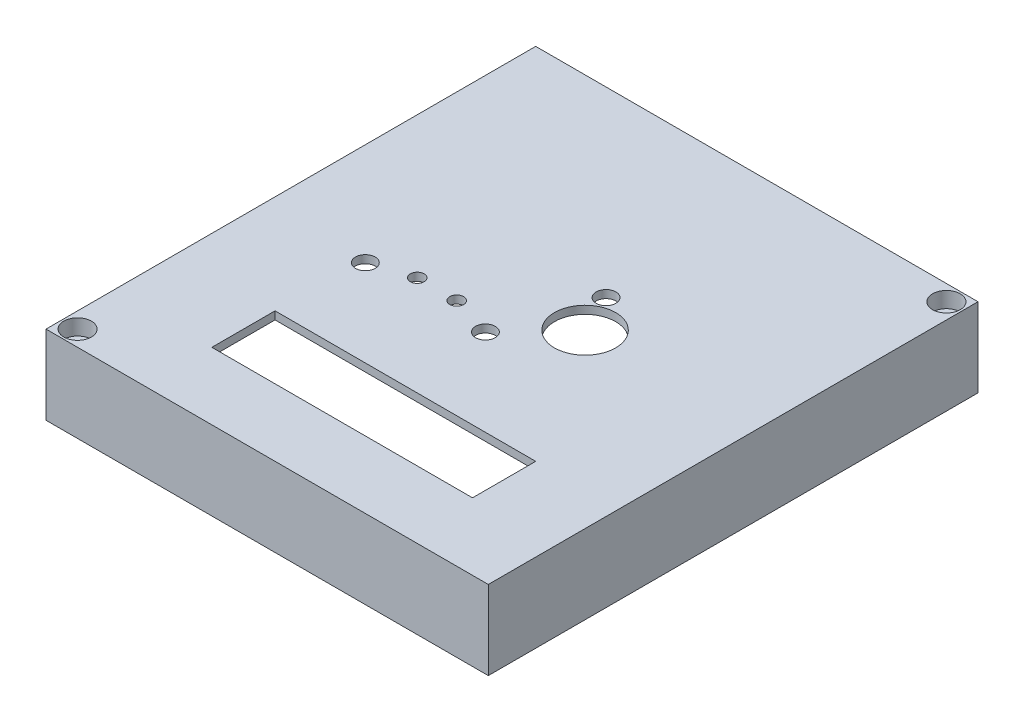
from build123d import *

# Parameters (mm, degrees)
SKETCH1_W           = 112
SKETCH1_H           = 124
BOSS_EXTRUDE1_DEPTH = 2
SKETCH4_W           = 112
SKETCH4_H           = 124
BOSS_EXTRUDE2_DEPTH = 18
CUT_EXTRUDE1_REACH  = 87.907
SKETCH5_W           = 66
SKETCH5_H           = 16
SKETCH5_R           = 7.75
SKETCH5_R_2         = 2.5
SKETCH5_R_3         = 1.75
SKETCH6_R           = 2
CUT_EXTRUDE2_DEPTH  = 86.90692638
SKETCH7_R           = 3.5
CUT_EXTRUDE3_DEPTH  = 4
CUT_EXTRUDE4_DEPTH  = 20
CUT_EXTRUDE5_REACH  = 139.244


with BuildPart() as part:
    # Sketch1 → Boss-Extrude1 (new body)
    with BuildSketch(Plane(origin=(0, 0, 0), x_dir=(1, 0, 0), z_dir=(0, 1, 0))):
        Rectangle(SKETCH1_W, SKETCH1_H)
    extrude(amount=BOSS_EXTRUDE1_DEPTH)

    # Sketch4 → Boss-Extrude2 (add)
    with BuildSketch(Plane.XZ):
        Rectangle(SKETCH4_W, SKETCH4_H)
        Polygon((-48, 58), (-48, 54), (-52, 54), (-52, -58), (48, -58), (48, -54), (52, -54), (52, 58), align=None, mode=Mode.SUBTRACT)
    extrude(amount=BOSS_EXTRUDE2_DEPTH)

    # Sketch5 → Cut-Extrude1 (cut, up to next)
    with BuildSketch(Plane(origin=(0, 2, 0), x_dir=(1, 0, 0), z_dir=(0, 1, 0)), mode=Mode.PRIVATE) as cut_extrude1_sk1:
        with Locations((2, -37)):
            Rectangle(SKETCH5_W, SKETCH5_H)
    cut_extrude1_tool1 = extrude(cut_extrude1_sk1.sketch, amount=-CUT_EXTRUDE1_REACH, mode=Mode.PRIVATE) & part.part
    # Sketch5 → Cut-Extrude1 (cut, up to next)
    with BuildSketch(Plane(origin=(0, 2, 0), x_dir=(1, 0, 0), z_dir=(0, 1, 0)), mode=Mode.PRIVATE) as cut_extrude1_sk2:
        with Locations((12.5, 6)):
            Circle(SKETCH5_R)
    cut_extrude1_tool2 = extrude(cut_extrude1_sk2.sketch, amount=-CUT_EXTRUDE1_REACH, mode=Mode.PRIVATE) & part.part
    # Sketch5 → Cut-Extrude1 (cut, up to next)
    with BuildSketch(Plane(origin=(0, 2, 0), x_dir=(1, 0, 0), z_dir=(0, 1, 0)), mode=Mode.PRIVATE) as cut_extrude1_sk3:
        with Locations((-30.13, -7.01)):
            Circle(SKETCH5_R_2)
    cut_extrude1_tool3 = extrude(cut_extrude1_sk3.sketch, amount=-CUT_EXTRUDE1_REACH, mode=Mode.PRIVATE) & part.part
    # Sketch5 → Cut-Extrude1 (cut, up to next)
    with BuildSketch(Plane(origin=(0, 2, 0), x_dir=(1, 0, 0), z_dir=(0, 1, 0)), mode=Mode.PRIVATE) as cut_extrude1_sk4:
        with Locations((-20.25, -3.7495)):
            Circle(SKETCH5_R_3)
    cut_extrude1_tool4 = extrude(cut_extrude1_sk4.sketch, amount=-CUT_EXTRUDE1_REACH, mode=Mode.PRIVATE) & part.part
    # Sketch5 → Cut-Extrude1 (cut, up to next)
    with BuildSketch(Plane(origin=(0, 2, 0), x_dir=(1, 0, 0), z_dir=(0, 1, 0)), mode=Mode.PRIVATE) as cut_extrude1_sk5:
        with Locations((-10.25, -3.7495)):
            Circle(SKETCH5_R_3)
    cut_extrude1_tool5 = extrude(cut_extrude1_sk5.sketch, amount=-CUT_EXTRUDE1_REACH, mode=Mode.PRIVATE) & part.part
    # Sketch5 → Cut-Extrude1 (cut, up to next)
    with BuildSketch(Plane(origin=(0, 2, 0), x_dir=(1, 0, 0), z_dir=(0, 1, 0)), mode=Mode.PRIVATE) as cut_extrude1_sk6:
        with Locations((0.2695, -7.01)):
            Circle(SKETCH5_R_2)
    cut_extrude1_tool6 = extrude(cut_extrude1_sk6.sketch, amount=-CUT_EXTRUDE1_REACH, mode=Mode.PRIVATE) & part.part
    # Sketch5 → Cut-Extrude1 (cut, up to next)
    with BuildSketch(Plane(origin=(0, 2, 0), x_dir=(1, 0, 0), z_dir=(0, 1, 0)), mode=Mode.PRIVATE) as cut_extrude1_sk7:
        with Locations((8.001, 15.811)):
            Circle(SKETCH5_R_2)
    cut_extrude1_tool7 = extrude(cut_extrude1_sk7.sketch, amount=-CUT_EXTRUDE1_REACH, mode=Mode.PRIVATE) & part.part
    add(cut_extrude1_tool1.solids().sort_by_distance((2, 2, 37))[0], mode=Mode.SUBTRACT)
    add(cut_extrude1_tool2.solids().sort_by_distance((12.5, 2, -6))[0], mode=Mode.SUBTRACT)
    add(cut_extrude1_tool3.solids().sort_by_distance((-30.13, 2, 7.01))[0], mode=Mode.SUBTRACT)
    add(cut_extrude1_tool4.solids().sort_by_distance((-20.25, 2, 3.7495))[0], mode=Mode.SUBTRACT)
    add(cut_extrude1_tool5.solids().sort_by_distance((-10.25, 2, 3.7495))[0], mode=Mode.SUBTRACT)
    add(cut_extrude1_tool6.solids().sort_by_distance((0.2695, 2, 7.01))[0], mode=Mode.SUBTRACT)
    add(cut_extrude1_tool7.solids().sort_by_distance((8.001, 2, -15.811))[0], mode=Mode.SUBTRACT)

    # Sketch6 → Cut-Extrude2 (cut, through all)
    with BuildSketch(Plane(origin=(0, 2, 0), x_dir=(1, 0, 0), z_dir=(0, 1, 0))):
        with Locations((52, 58)):
            Circle(SKETCH6_R)
        with Locations((-52, -58)):
            Circle(SKETCH6_R)
    extrude(amount=-CUT_EXTRUDE2_DEPTH, mode=Mode.SUBTRACT)

    # Sketch7 → Cut-Extrude3 (cut)
    with BuildSketch(Plane(origin=(0, 2, 0), x_dir=(1, 0, 0), z_dir=(0, 1, 0))):
        with Locations((-52, -58)):
            Circle(SKETCH7_R)
        with Locations((52, 58)):
            Circle(SKETCH7_R)
    extrude(amount=-CUT_EXTRUDE3_DEPTH, mode=Mode.SUBTRACT)

    # Sketch8 → Cut-Extrude4 (cut)
    with BuildSketch(Plane.ZY.offset(56)):
        with BuildLine():
            Line((-49, -2.687151264), (-39, -2.687151264))
            ThreePointArc((-39, -2.687151264), (-34, -7.687151264), (-39, -12.687151264))
            Line((-39, -12.687151264), (-49, -12.687151264))
            ThreePointArc((-49, -12.687151264), (-54, -7.687151264), (-49, -2.687151264))
        make_face()
        with BuildLine():
            Line((-28, -2.687151264), (-18, -2.687151264))
            ThreePointArc((-18, -2.687151264), (-13, -7.687151264), (-18, -12.687151264))
            Line((-18, -12.687151264), (-28, -12.687151264))
            ThreePointArc((-28, -12.687151264), (-33, -7.687151264), (-28, -2.687151264))
        make_face()
        with BuildLine():
            Line((-8.5, -4.687151264), (-3.5, -4.687151264))
            ThreePointArc((-3.5, -4.687151264), (-0.5, -7.687151264), (-3.5, -10.687151264))
            Line((-3.5, -10.687151264), (-8.5, -10.687151264))
            ThreePointArc((-8.5, -10.687151264), (-11.5, -7.687151264), (-8.5, -4.687151264))
        make_face()
    extrude(amount=-CUT_EXTRUDE4_DEPTH, mode=Mode.SUBTRACT)

    # Sketch9 → Cut-Extrude5 (cut, up to next)
    with BuildSketch(Plane(origin=(0, 0, -62), x_dir=(-1, 0, 0), z_dir=(0, 0, -1)), mode=Mode.PRIVATE) as cut_extrude5_sk1:
        with BuildLine():
            Line((-28, -12.5), (-38, -12.5))
            ThreePointArc((-38, -12.5), (-40.5, -10), (-38, -7.5))
            Line((-38, -7.5), (-28, -7.5))
            ThreePointArc((-28, -7.5), (-25.5, -10), (-28, -12.5))
        make_face()
    cut_extrude5_tool1 = extrude(cut_extrude5_sk1.sketch, amount=-CUT_EXTRUDE5_REACH, mode=Mode.PRIVATE) & part.part
    add(cut_extrude5_tool1.solids().sort_by_distance((33, -10, -62))[0], mode=Mode.SUBTRACT)


solid = part.part
